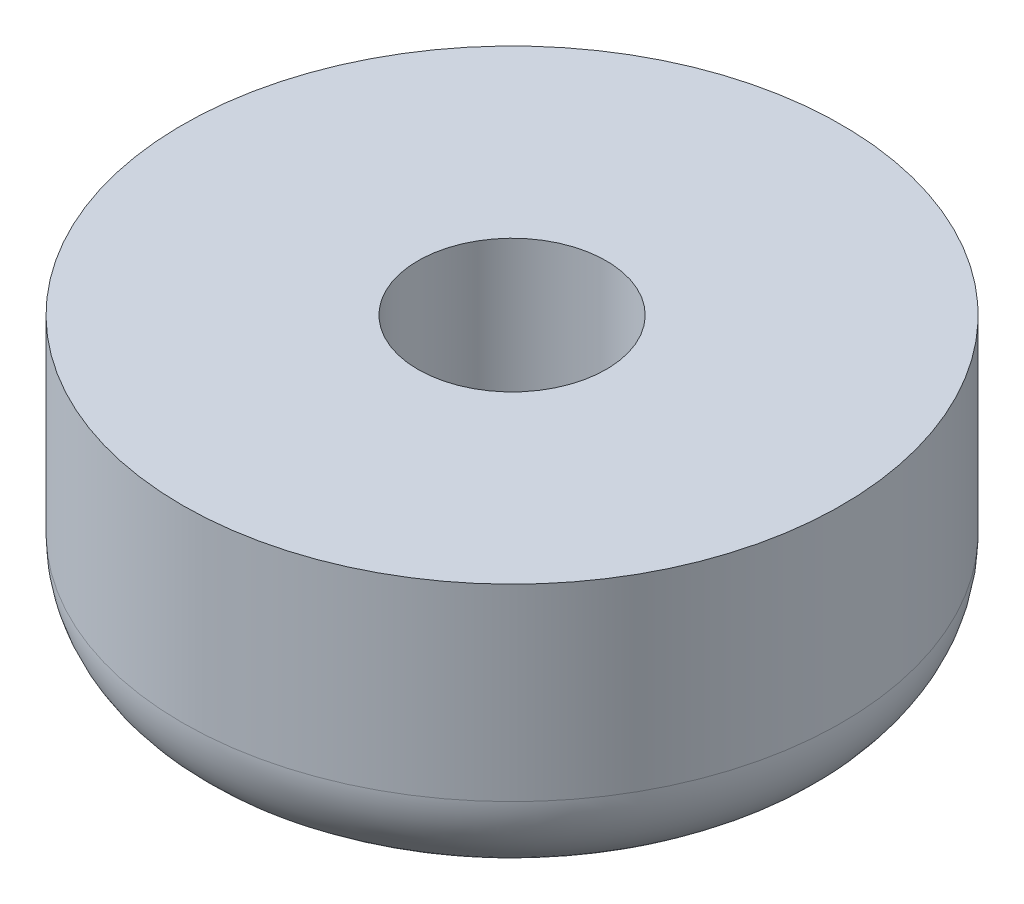
from build123d import *

# Parameters (mm, degrees)
SKETCH1_R           = 3.5
BOSS_EXTRUDE1_DEPTH = 3
SKETCH2_R           = 1
CUT_EXTRUDE1_DEPTH  = 2
FILLET1_R           = 1


with BuildPart() as part:
    # Sketch1 → Boss-Extrude1 (new body)
    with BuildSketch(Plane(origin=(0, 0, 0), x_dir=(1, 0, 0), z_dir=(0, 1, 0))):
        Circle(SKETCH1_R)
    extrude(amount=BOSS_EXTRUDE1_DEPTH)

    # Sketch2 → Cut-Extrude1 (cut)
    with BuildSketch(Plane(origin=(0, 3, 0), x_dir=(1, 0, 0), z_dir=(0, 1, 0))):
        Circle(SKETCH2_R)
    extrude(amount=-CUT_EXTRUDE1_DEPTH, mode=Mode.SUBTRACT)

    # Fillet1
    fillet1_edges = [part.edges().sort_by_distance(p)[0] for p in [
        (-3.5, 0, 0),
    ]]
    fillet(fillet1_edges, radius=FILLET1_R)


solid = part.part
